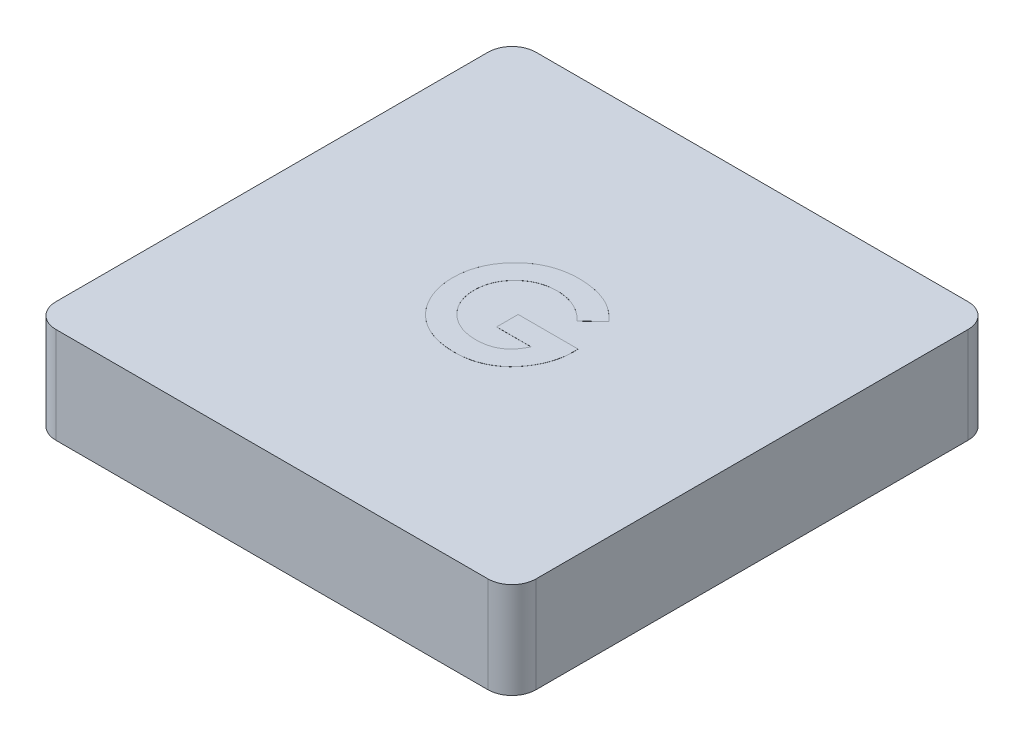
from build123d import *

# Parameters (mm, degrees)
SKETCH1_W           = 12.7
SKETCH1_H           = 12.7
BOSS_EXTRUDE1_DEPTH = 2.54
FILLET1_R           = 0.635
SHELL1_START        = 0.635
SHELL1_OUTLINE_W    = 1.905
SHELL1_OUTLINE_H    = 11.43
SHELL1_DEPTH        = 11.43
SKETCH2_R           = 2.54
BOSS_EXTRUDE2_DEPTH = 1.905
BOSS_EXTRUDE3_DEPTH = 0.00254


# Read off the part's stored shape, not the designer's step: Shell1
with BuildPart() as part:
    # Sketch1 → Boss-Extrude1 (new body)
    with BuildSketch(Plane(origin=(0, 0, 0), x_dir=(1, 0, 0), z_dir=(0, 1, 0))):
        with Locations((6.35, 6.35)):
            Rectangle(SKETCH1_W, SKETCH1_H)
    extrude(amount=BOSS_EXTRUDE1_DEPTH)

    # Fillet1
    fillet1_edges = [part.edges().sort_by_distance(p)[0] for p in [
        (0, 1.27, -12.7),
        (12.7, 1.27, -12.7),
        (12.7, 1.27, 0),
        (0, 1.27, 0),
    ]]
    fillet(fillet1_edges, radius=FILLET1_R)

    # Shell1 outline → Shell1 (cut)
    with BuildSketch(Plane.YZ.offset(SHELL1_START)):
        with Locations((0.9525, -6.35)):
            Rectangle(SHELL1_OUTLINE_W, SHELL1_OUTLINE_H)
    extrude(amount=SHELL1_DEPTH, mode=Mode.SUBTRACT)

    # Sketch2 → Boss-Extrude2 (add)
    with BuildSketch(Plane(origin=(0, 1.905, 0), x_dir=(-1, 0, 0), z_dir=(0, -1, 0))):
        with Locations(Location((-6.35, 6.35, 0), (0, 0, 270))):
            Circle(SKETCH2_R)
    extrude(amount=BOSS_EXTRUDE2_DEPTH)

    # Sketch3 → Boss-Extrude3 (add)
    with BuildSketch(Plane(origin=(0, 2.54, 0), x_dir=(1, 0, 0), z_dir=(0, 1, 0))):
        with BuildLine():
            Line((7.771926803, 7.496002003), (7.340706851, 7.083226562))
            add(Edge.make_bspline(
                [(7.340706851, 7.083226562), (7.306566415, 7.117407905), (7.239577243, 7.184477342), (7.130024832, 7.271772823), (7.016561783, 7.345991239), (6.898814643, 7.407018813), (6.776619389, 7.454357105), (6.650217166, 7.4882197), (6.519402332, 7.508304178), (6.430846529, 7.511115937), (6.386044391, 7.512538462)],
                knots=[0, 0, 0, 0, 1.075575784, 2.110457258, 3.113929901, 4.09197124, 5.059417775, 6.02750972, 7.002078037, 8, 8, 8, 8], degree=3))
            add(Edge.make_bspline(
                [(6.386044391, 7.512538462), (6.347202307, 7.511541705), (6.270932472, 7.509584486), (6.158861293, 7.494721502), (6.051770417, 7.469893554), (5.949153902, 7.435498578), (5.851638258, 7.390739844), (5.758658459, 7.33630815), (5.670786706, 7.271787088), (5.588714925, 7.198399755), (5.513988304, 7.118275604), (5.448748017, 7.03251443), (5.39317731, 6.942714749), (5.347431283, 6.848417132), (5.312623532, 6.749766307), (5.287775353, 6.64683389), (5.272002938, 6.539919017), (5.270140687, 6.466980583), (5.269197436, 6.430036458)],
                knots=[0, 0, 0, 0, 1.075001177, 2.110859044, 3.123021556, 4.114053297, 5.101481495, 6.087880186, 7.091499647, 8.114004866, 9.131394192, 10.11971144, 11.092043119, 12.050101265, 13.015322563, 13.981809771, 14.977764287, 16, 16, 16, 16], degree=3))
            add(Edge.make_bspline(
                [(5.269197436, 6.430036458), (5.270077255, 6.391813648), (5.271810619, 6.316509478), (5.288461543, 6.205997372), (5.314115158, 6.099676762), (5.35166521, 5.998336523), (5.397877952, 5.900588436), (5.456483323, 5.808325972), (5.52482305, 5.720140184), (5.602775019, 5.637566437), (5.687566632, 5.561453315), (5.779398707, 5.495796177), (5.87547715, 5.439148239), (5.977352671, 5.394284903), (6.083257013, 5.358264559), (6.19426435, 5.332867125), (6.31012472, 5.317285888), (6.389175206, 5.31541236), (6.42929359, 5.314461538)],
                knots=[0, 0, 0, 0, 1.022067601, 2.013613092, 2.983553406, 3.943623673, 4.90013463, 5.87121881, 6.861774014, 7.881098904, 8.905697761, 9.905387765, 10.89678721, 11.884561068, 12.87834324, 13.885584958, 14.926927371, 16, 16, 16, 16], degree=3))
            add(Edge.make_bspline(
                [(6.42929359, 5.314461538), (6.455389112, 5.314696994), (6.50662043, 5.315159245), (6.581768042, 5.322662884), (6.653741405, 5.333390208), (6.722819251, 5.347591911), (6.78830408, 5.367689869), (6.851102574, 5.391191957), (6.910846789, 5.418929106), (6.967212798, 5.4518583), (7.021039491, 5.488767902), (7.07182304, 5.531000335), (7.120454247, 5.577603414), (7.166364864, 5.629146461), (7.20877784, 5.686090332), (7.249051978, 5.747388607), (7.286726148, 5.813649634), (7.308986821, 5.860439815), (7.320354287, 5.884333333)],
                knots=[0, 0, 0, 0, 1.109579412, 2.178351274, 3.208885622, 4.204702371, 5.174744997, 6.119429583, 7.05542196, 7.97267548, 8.893247984, 9.828544973, 10.778894627, 11.756245826, 12.760884819, 13.796418446, 14.874735809, 16, 16, 16, 16], degree=3))
            Line((7.320354287, 5.884333333), (6.408941026, 5.884333333))
            Line((6.408941026, 5.884333333), (6.408941026, 6.454205128))
            Line((6.408941026, 6.454205128), (7.991988902, 6.454205128))
            Line((7.991988902, 6.454205128), (7.996441026, 6.318733373))
            add(Edge.make_bspline(
                [(7.996441026, 6.318733373), (7.995868961, 6.283940789), (7.994725852, 6.214417712), (7.984279039, 6.110909693), (7.966974052, 6.008774494), (7.943316479, 5.908114696), (7.913667554, 5.808436526), (7.875855895, 5.710694487), (7.831578672, 5.614225725), (7.781969186, 5.519440156), (7.726222397, 5.428490826), (7.666202793, 5.342373816), (7.602765995, 5.261238176), (7.534532278, 5.18621433), (7.462564154, 5.116672044), (7.386719952, 5.052878855), (7.306731416, 4.994780786), (7.223022277, 4.941887042), (7.13511573, 4.895528796), (7.043495085, 4.855203272), (6.948298678, 4.820955656), (6.849280734, 4.792880061), (6.746636094, 4.771217506), (6.64036256, 4.756363463), (6.530401766, 4.746269974), (6.455817686, 4.745156592), (6.417845272, 4.744589744)],
                knots=[0, 0, 0, 0, 1.006889344, 2.011981806, 3.007738725, 4.003571281, 5.003404394, 6.015442001, 7.03424805, 8.074616296, 9.110249922, 10.119753985, 11.111721717, 12.089233633, 13.052717867, 14.006597561, 14.955430184, 15.912305663, 16.870361111, 17.829300583, 18.807640451, 19.796414044, 20.806216501, 21.841577364, 22.90109906, 24, 24, 24, 24], degree=3))
            add(Edge.make_bspline(
                [(6.417845272, 4.744589744), (6.377331282, 4.745149516), (6.297020469, 4.746259153), (6.178270169, 4.756651657), (6.062964889, 4.773803815), (5.951075868, 4.797541814), (5.842343325, 4.827085651), (5.736954077, 4.864170155), (5.635123675, 4.908283344), (5.536547184, 4.958257086), (5.442484518, 5.014931662), (5.353146488, 5.077313277), (5.269020717, 5.145803203), (5.189245497, 5.219254905), (5.115684686, 5.299473831), (5.045596958, 5.383859699), (4.982377825, 5.475507443), (4.923309052, 5.571445818), (4.870831882, 5.671634621), (4.824939843, 5.774220808), (4.785803137, 5.878610404), (4.754942899, 5.985289482), (4.729887276, 6.093514186), (4.711959507, 6.203755162), (4.701834859, 6.315998608), (4.70016576, 6.391432018), (4.699325641, 6.429400441)],
                knots=[0, 0, 0, 0, 1.084149091, 2.14910686, 3.187506334, 4.202448172, 5.208724393, 6.201130722, 7.189831603, 8.176984443, 9.156919086, 10.126598231, 11.090766514, 12.05840148, 13.026036446, 14.001772938, 14.991905635, 16.003017641, 17.015720547, 18.016462227, 19.009322657, 19.99686681, 20.986544154, 21.980959929, 22.983742515, 24, 24, 24, 24], degree=3))
            add(Edge.make_bspline(
                [(4.699325641, 6.429400441), (4.70045074, 6.481197483), (4.702672477, 6.583481286), (4.72324913, 6.734145976), (4.755325067, 6.87989903), (4.801357267, 7.020209626), (4.860427449, 7.155271043), (4.931698831, 7.285400345), (5.016719582, 7.410459214), (5.082531483, 7.487888023), (5.115917187, 7.527166867)],
                knots=[0, 0, 0, 0, 1.034044851, 2.041932006, 3.031217818, 4.011390712, 4.986069675, 5.97149666, 6.970960976, 8, 8, 8, 8], degree=3))
            add(Edge.make_bspline(
                [(5.115917187, 7.527166867), (5.136646046, 7.549890869), (5.177792517, 7.59499767), (5.243565077, 7.657674489), (5.311005647, 7.716593018), (5.381048291, 7.770503925), (5.453324806, 7.820587348), (5.528043218, 7.865904431), (5.604811571, 7.907898096), (5.684228565, 7.944423986), (5.765878441, 7.977172494), (5.850122815, 8.004882336), (5.936330711, 8.02942667), (6.025265506, 8.048098613), (6.116028744, 8.063647182), (6.209264693, 8.074068647), (6.304719281, 8.081706839), (6.369279964, 8.082173929), (6.401944832, 8.082410256)],
                knots=[0, 0, 0, 0, 1.020590567, 2.025856924, 3.013483481, 3.991664875, 4.957826714, 5.930500614, 6.890802512, 7.860442893, 8.829981142, 9.809047939, 10.802672283, 11.803273349, 12.823572789, 13.857849586, 14.916166035, 16, 16, 16, 16], degree=3))
            add(Edge.make_bspline(
                [(6.401944832, 8.082410256), (6.436090224, 8.081883676), (6.504027016, 8.080835974), (6.605037776, 8.073586558), (6.704644924, 8.062402419), (6.802428705, 8.045625571), (6.898717283, 8.024936226), (6.993012244, 7.998428055), (7.085928747, 7.968309997), (7.146417038, 7.944297656), (7.176614303, 7.932310096)],
                knots=[0, 0, 0, 0, 1.03180557, 2.052914215, 3.058998889, 4.059601663, 5.049854447, 6.033765722, 7.018406786, 8, 8, 8, 8], degree=3))
            add(Edge.make_bspline(
                [(7.176614303, 7.932310096), (7.202021565, 7.921231433), (7.253699235, 7.898697739), (7.328883874, 7.857471289), (7.40425221, 7.811767038), (7.47899098, 7.759913932), (7.552986303, 7.70200896), (7.62701077, 7.638966722), (7.70030871, 7.570052109), (7.747744937, 7.521005039), (7.771926803, 7.496002003)],
                knots=[0, 0, 0, 0, 0.894392155, 1.819168899, 2.76525314, 3.739198753, 4.75366411, 5.797420238, 6.877176959, 8, 8, 8, 8], degree=3))
        make_face()
    extrude(amount=BOSS_EXTRUDE3_DEPTH)


solid = part.part
